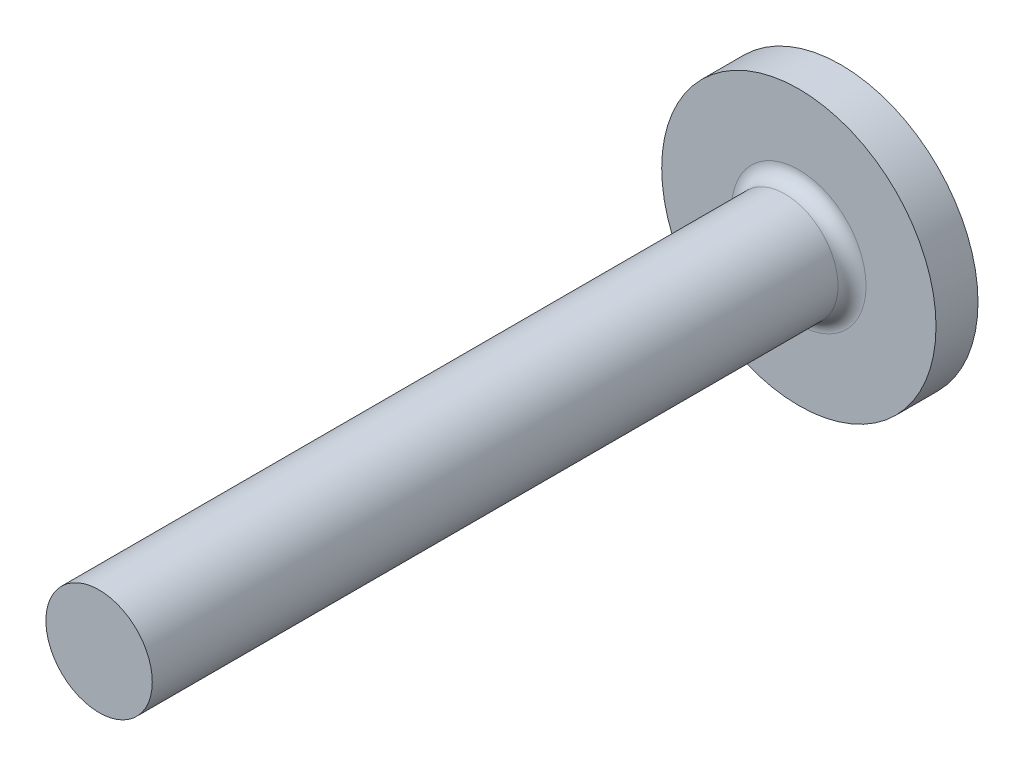
from build123d import *

# Parameters (mm, degrees)
SKETCH1_R           = 3.8
BOSS_EXTRUDE1_DEPTH = 50
SKETCH1_3_R         = 9.8
BOSS_EXTRUDE2_DEPTH = 3
FILLET1_R           = 1


with BuildPart() as part:
    # Sketch1 → Boss-Extrude1 (new body)
    with BuildSketch(Plane.XY):
        Circle(SKETCH1_R)
    extrude(amount=BOSS_EXTRUDE1_DEPTH)

    # Sketch1<3> → Boss-Extrude2 (add)
    with BuildSketch(Plane.XY):
        Circle(SKETCH1_3_R)
    extrude(amount=-BOSS_EXTRUDE2_DEPTH)

    # Fillet1
    fillet1_edges = [part.edges().sort_by_distance(p)[0] for p in [
        (-3.8, 0, 0),
    ]]
    fillet(fillet1_edges, radius=FILLET1_R)


solid = part.part
